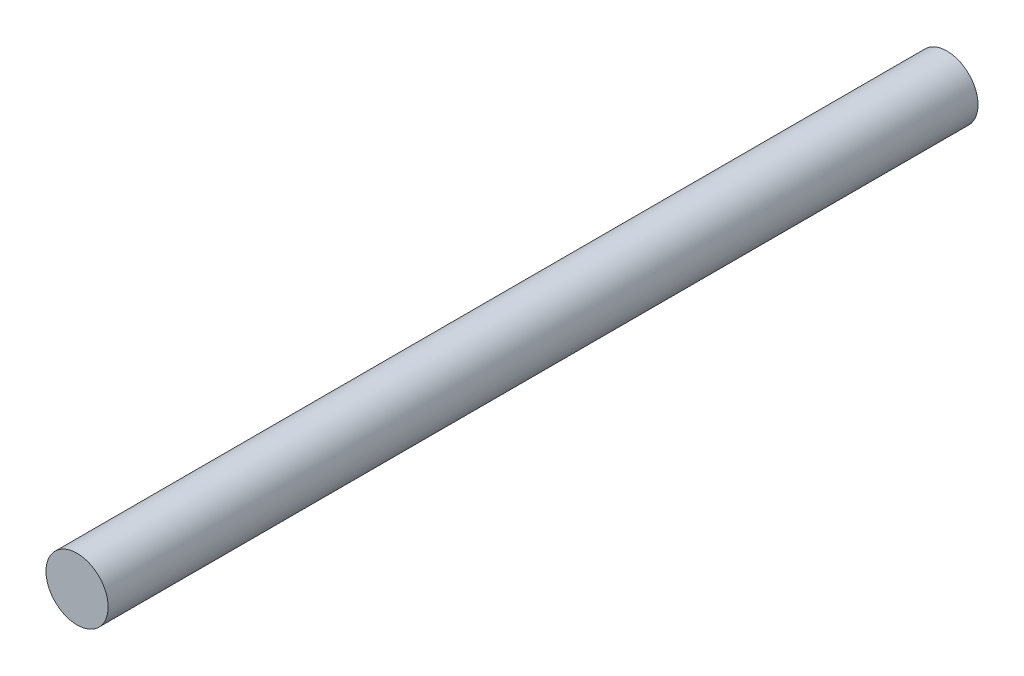
from build123d import *

# Parameters (mm, degrees)
SKETCH1_R           = 5
BOSS_EXTRUDE1_DEPTH = 150
SKETCH2_R           = 5
CUT_EXTRUDE1_DEPTH  = 10


with BuildPart() as part:
    # Sketch1 → Boss-Extrude1 (new body)
    with BuildSketch(Plane.XY):
        Circle(SKETCH1_R)
    extrude(amount=BOSS_EXTRUDE1_DEPTH)

    # Sketch2 → Cut-Extrude1 (cut)
    with BuildSketch(Plane(origin=(0, 0, 0), x_dir=(-1, 0, 0), z_dir=(0, 0, -1))):
        Circle(SKETCH2_R)
    extrude(amount=-CUT_EXTRUDE1_DEPTH, mode=Mode.SUBTRACT)


solid = part.part
